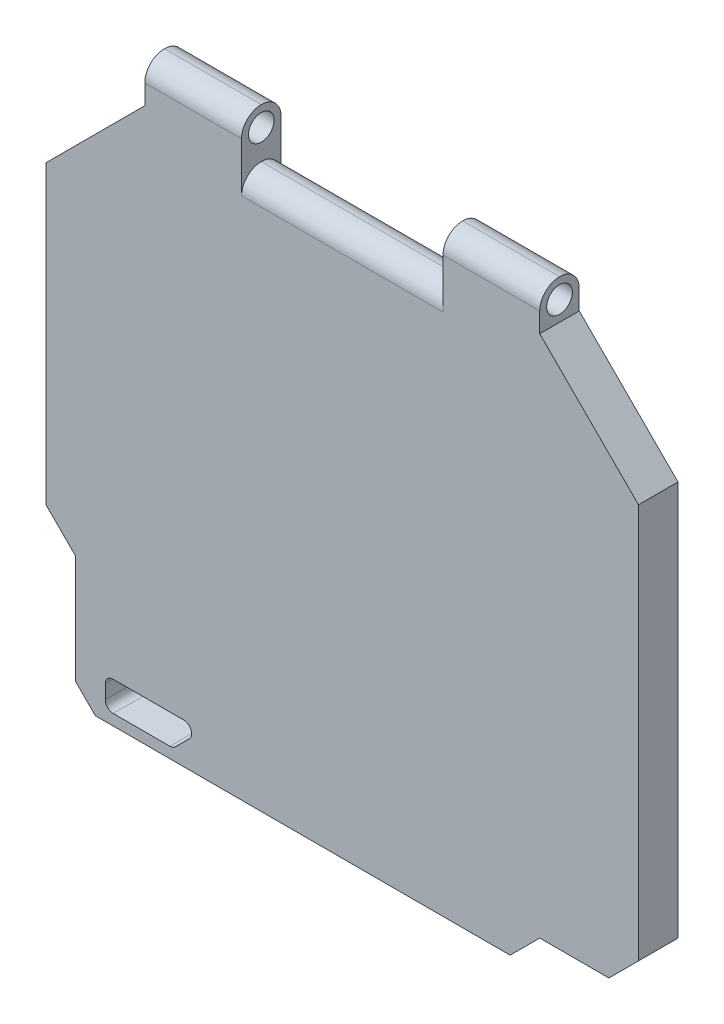
from build123d import *

# Parameters (mm, degrees)
SKETCH_1_W               = 30
SKETCH_1_H               = 30
EXTRUDE_1_DEPTH          = 2
SKETCH_2_W               = 10.2
SKETCH_2_H               = 2
CUT_EXTRUDE_1_DEPTH      = 2.5
CUT_EXTRUDE_3_DEPTH      = 43
CHAMFER_1_SIZE           = 1.5
CUT_EXTRUDE_4_DEPTH      = 0.5
FILLET_1_R               = 1
CUT_EXTRUDE_2_DEPTH      = 43
CUT_EXTRUDE_2_DEPTH_BACK = 43
SKETCH_3_R               = 0.65
CUT_EXTRUDE_7_DEPTH      = 0.5
CUT_EXTRUDE_8_DEPTH      = 10
CUT_EXTRUDE_9_DEPTH      = 10
CHAMFER_2_SIZE           = 1
CUT_EXTRUDE_10_DEPTH     = 10


with BuildPart() as part:
    # 草图1 → 凸台-拉伸1 (new body)
    with BuildSketch(Plane.XY):
        Rectangle(SKETCH_1_W, SKETCH_1_H)
    extrude(amount=EXTRUDE_1_DEPTH)

    # 草图2 → 切除-拉伸1 (cut)
    with BuildSketch(Plane(origin=(0, 15, 0), x_dir=(1, 0, 0), z_dir=(0, 1, 0))):
        with Locations((0, -1)):
            Rectangle(SKETCH_2_W, SKETCH_2_H)
    extrude(amount=-CUT_EXTRUDE_1_DEPTH, mode=Mode.SUBTRACT)

    # 草图4 → 切除-拉伸3 (cut)
    with BuildSketch(Plane(origin=(0, 0, 0), x_dir=(-1, 0, 0), z_dir=(0, 0, -1))):
        Polygon((-10, -13.5), (-8.5, -15), (-10, -15), (-15, -15), (-15, -13.5), align=None)
    extrude(amount=-CUT_EXTRUDE_3_DEPTH, mode=Mode.SUBTRACT)

    # 倒角1
    chamfer_1_edges = [part.edges().sort_by_distance(p)[0] for p in [
        (15, -13.5, 1),
    ]]
    chamfer(chamfer_1_edges, length=CHAMFER_1_SIZE)

    # 草图5 → 切除-拉伸4 (cut)
    with BuildSketch(Plane(origin=(0, 0, 0), x_dir=(-1, 0, 0), z_dir=(0, 0, -1))):
        Polygon((-15, -12), (-5, -12), (-2, -15), (-8.5, -15), (-10, -13.5), (-13.5, -13.5), align=None)
    extrude(amount=-CUT_EXTRUDE_4_DEPTH, mode=Mode.SUBTRACT)

    # 圆角1
    fillet_1_edges = [part.edges().sort_by_distance(p)[0] for p in [
        (10.05, 15, 2),
        (10.05, 15, 0),
        (-10.05, 15, 2),
        (-10.05, 15, 0),
        (0, 12.5, 2),
        (0, 12.5, 0),
    ]]
    fillet(fillet_1_edges, radius=FILLET_1_R - 0.0001)  # a hair under: the kernel refuses the full size

    # 草图3 → 切除-拉伸2 (cut, two sides: drawn at the far end of the back side and taken through both)
    with BuildSketch(Plane(origin=(-5.1, 0, 0), x_dir=(0, 0, -1), z_dir=(1, 0, 0)).offset(-CUT_EXTRUDE_2_DEPTH_BACK)):
        with Locations(Location((-1, 14, 0), (0, 0, 180))):
            Circle(SKETCH_3_R)
    extrude(amount=CUT_EXTRUDE_2_DEPTH + CUT_EXTRUDE_2_DEPTH_BACK, mode=Mode.SUBTRACT)

    # 草图9 → 切除-拉伸7 (cut)
    with BuildSketch(Plane(origin=(0, 0, 0), x_dir=(-1, 0, 0), z_dir=(0, 0, -1))):
        with BuildLine():
            Line((-2.293324317, -12.585355339), (-0.407968978, -14.470710678))
            ThreePointArc((-0.407968978, -14.470710678), (-0.375526643, -14.492387953), (-0.3372583, -14.5))
            Line((-0.3372583, -14.5), (1.500609665, -14.5))
            ThreePointArc((1.500609665, -14.5), (1.546803642, -14.469134172), (1.535965005, -14.414644661))
            Line((1.535965005, -14.414644661), (-0.349390335, -12.529289322))
            ThreePointArc((-0.349390335, -12.529289322), (-0.381832669, -12.507612047), (-0.420101013, -12.5))
            Line((-0.420101013, -12.5), (-2.257968978, -12.5))
            ThreePointArc((-2.257968978, -12.5), (-2.304162955, -12.530865828), (-2.293324317, -12.585355339))
        make_face()
        with BuildLine():
            Line((2.579898987, -12.5), (0.742031022, -12.5))
            ThreePointArc((0.742031022, -12.5), (0.695837045, -12.530865828), (0.706675683, -12.585355339))
            Line((0.706675683, -12.585355339), (2.592031022, -14.470710678))
            ThreePointArc((2.592031022, -14.470710678), (2.624473357, -14.492387953), (2.6627417, -14.5))
            Line((2.6627417, -14.5), (4.500609665, -14.5))
            ThreePointArc((4.500609665, -14.5), (4.546803642, -14.469134172), (4.535965005, -14.414644661))
            Line((4.535965005, -14.414644661), (2.650609665, -12.529289322))
            ThreePointArc((2.650609665, -12.529289322), (2.618167331, -12.507612047), (2.579898987, -12.5))
        make_face()
        with BuildLine():
            Line((5.579898987, -12.5), (3.742031022, -12.5))
            ThreePointArc((3.742031022, -12.5), (3.695837045, -12.530865828), (3.706675683, -12.585355339))
            Line((3.706675683, -12.585355339), (5.592031022, -14.470710678))
            ThreePointArc((5.592031022, -14.470710678), (5.624473357, -14.492387953), (5.6627417, -14.5))
            Line((5.6627417, -14.5), (7.500609665, -14.5))
            ThreePointArc((7.500609665, -14.5), (7.546803642, -14.469134172), (7.535965005, -14.414644661))
            Line((7.535965005, -14.414644661), (5.650609665, -12.529289322))
            ThreePointArc((5.650609665, -12.529289322), (5.618167331, -12.507612047), (5.579898987, -12.5))
        make_face()
    extrude(amount=-CUT_EXTRUDE_7_DEPTH, mode=Mode.SUBTRACT)

    # 草图10 → 切除-拉伸8 (cut)
    with BuildSketch(Plane(origin=(0, 0, 0), x_dir=(-1, 0, 0), z_dir=(0, 0, -1))):
        with BuildLine():
            Line((8.026955262, -12.95), (11.6, -12.95))
            ThreePointArc((11.6, -12.95), (11.882842712, -13.067157288), (12, -13.35))
            Line((12, -13.35), (12, -14.05))
            ThreePointArc((12, -14.05), (11.882842712, -14.332842712), (11.6, -14.45))
            Line((11.6, -14.45), (8.726955262, -14.45))
            ThreePointArc((8.726955262, -14.45), (8.573881889, -14.419551813), (8.44411255, -14.332842712))
            Line((8.44411255, -14.332842712), (7.74411255, -13.632842712))
            ThreePointArc((7.74411255, -13.632842712), (7.657403449, -13.196926627), (8.026955262, -12.95))
        make_face()
    extrude(amount=-CUT_EXTRUDE_8_DEPTH, mode=Mode.SUBTRACT)

    # 草图11 → 切除-拉伸9 (cut)
    with BuildSketch(Plane(origin=(0, 0, 0), x_dir=(-1, 0, 0), z_dir=(0, 0, -1))):
        Polygon((15, -7), (13.5, -8.5), (13.5, -15), (15, -15), align=None)
    extrude(amount=-CUT_EXTRUDE_9_DEPTH, mode=Mode.SUBTRACT)

    # 倒角2
    chamfer_2_edges = [part.edges().sort_by_distance(p)[0] for p in [
        (-13.5, -15, 1),
    ]]
    chamfer(chamfer_2_edges, length=CHAMFER_2_SIZE)

    # 草图12 → 切除-拉伸10 (cut)
    with BuildSketch(Plane(origin=(0, 0, 0), x_dir=(-1, 0, 0), z_dir=(0, 0, -1))):
        Polygon((10, 15), (10, 13), (13, 10), (15, 8), (15, 15), align=None)
    cut_extrude_10 = extrude(amount=-CUT_EXTRUDE_10_DEPTH, mode=Mode.SUBTRACT)

    # 镜向4: 切除-拉伸10 across plane
    add(cut_extrude_10.mirror(Plane(origin=(0, 0, 0), x_dir=(0, 0, 1), z_dir=(1, 0, 0))), mode=Mode.SUBTRACT)


solid = part.part
